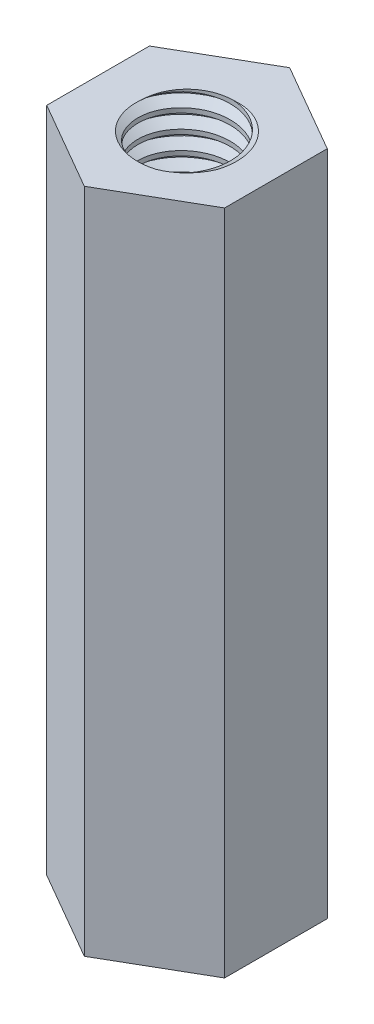
from build123d import *

# Parameters (mm, degrees)
SKETCH1_R           = 1.25
BOSS_EXTRUDE1_DEPTH = 9
THREAD1_PITCH       = 0.5
BOSS_EXTRUDE2_DEPTH = 4


with BuildPart() as part:
    # Sketch1 → Boss-Extrude1 (new, symmetric)
    with BuildSketch(Plane(origin=(0, 0, 0), x_dir=(1, 0, 0), z_dir=(0, 1, 0))):
        Polygon((2.4, 1.385640646), (0, 2.771281292), (-2.4, 1.385640646), (-2.4, -1.385640646), (0, -2.771281292), (2.4, -1.385640646), align=None)
        with Locations(Location((0, 0, 0), (0, 0, 270))):
            Circle(SKETCH1_R, mode=Mode.SUBTRACT)
    extrude(amount=BOSS_EXTRUDE1_DEPTH, both=True)

    # Thread1: the profile of Thread Profile1 profile screwed along a right-hand helix of 44 turns, 6 arcs to a turn; built about Z, then put on its axis
    thread1_z = Axis((0, 0, 0), (0, 0, 1))
    thread1_corners = [(1.2497, 0, -0.000173205), (1.520632938, 0, 0.156249999), (1.520632937, 0, 0.218749999), (1.2497, 0, 0.375173204)]
    with BuildLine(mode=Mode.PRIVATE) as thread1_profile:
        Line(thread1_corners[0], thread1_corners[1])
        Line(thread1_corners[1], thread1_corners[2])
        Line(thread1_corners[2], thread1_corners[3])
        Line(thread1_corners[3], thread1_corners[0])
    thread1_cap = Face(thread1_profile.wire())
    thread1_turn_angles = [0, 30, 60, 90, 120, 150, 180, 210, 240, 270, 300, 330, 360, 390, 420, 450, 480, 510, 540, 570, 600, 630, 660, 690, 720]
    thread1_turn_weights = [1, 0.8660254037844387, 1, 0.8660254037844387, 1, 0.8660254037844387, 1, 0.8660254037844387, 1, 0.8660254037844387, 1, 0.8660254037844387, 1, 0.8660254037844387, 1, 0.8660254037844387, 1, 0.8660254037844387, 1, 0.8660254037844387, 1, 0.8660254037844387, 1, 0.8660254037844387, 1]
    thread1_turn_rails = [Edge.make_bspline([Vector(p[0], p[1], 0).rotate(thread1_z, thread1_turn_angles[k]) / thread1_turn_weights[k] + Vector(0, 0, p[2] + THREAD1_PITCH * thread1_turn_angles[k] / 360) for k in range(25)], [0, 0, 0, 1, 1, 2, 2, 3, 3, 4, 4, 5, 5, 6, 6, 7, 7, 8, 8, 9, 9, 10, 10, 11, 11, 12, 12, 12], 2, thread1_turn_weights) for p in thread1_corners]
    thread1_turn_sides = [Face.make_surface_from_curves(thread1_turn_rails[p[0]], thread1_turn_rails[p[1]]) for p in [(0, 1), (1, 2), (2, 3), (3, 0)]]
    thread1 = Plane(origin=(0, 11, 0), x_dir=(-1, 0, 0), z_dir=(0, -1, 0)) * Solid(Shell([*[p.moved(Location((0, 0, 2 * THREAD1_PITCH * i))) for i in range(22) for p in thread1_turn_sides], thread1_cap, thread1_cap.rotate(thread1_z, 15840).moved(Location((0, 0, THREAD1_PITCH * 15840 / 360)))]))
    add(thread1, mode=Mode.SUBTRACT)

    # Sketch3 → Boss-Extrude2 (add, symmetric)
    with BuildSketch(Plane(origin=(0, 0, 0), x_dir=(1, 0, 0), z_dir=(0, 1, 0))):
        Polygon((2.4, -1.385640646), (2.4, 1.385640646), (0, 2.771281292), (-2.4, 1.385640646), (-2.4, -1.385640646), (0, -2.771281292), align=None)
    extrude(amount=BOSS_EXTRUDE2_DEPTH, both=True)


solid = part.part
